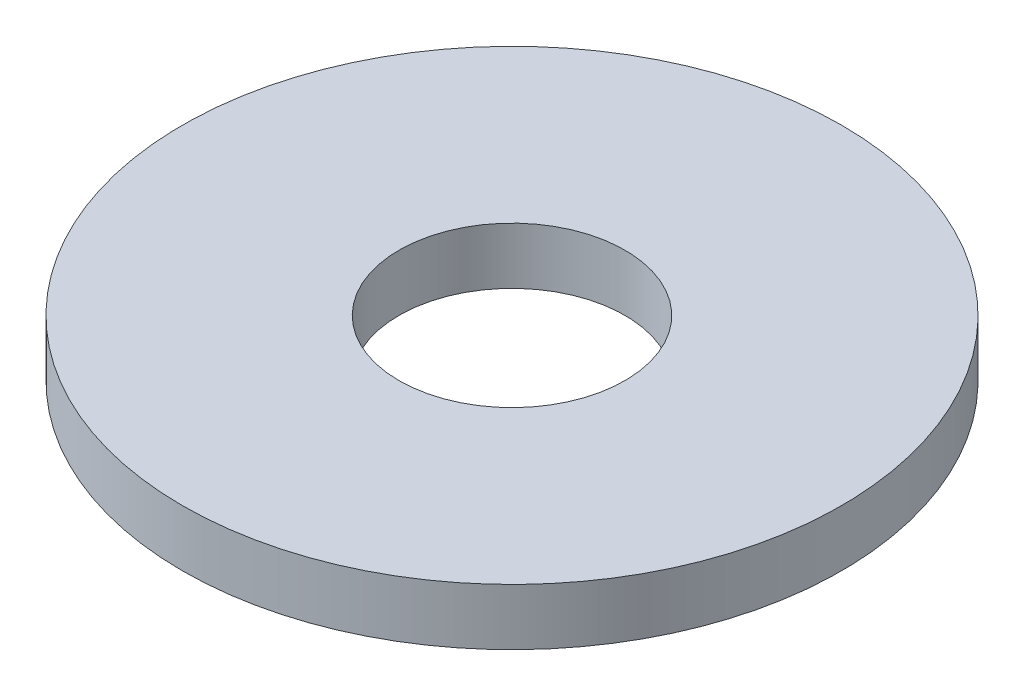
from build123d import *

# Parameters (mm, degrees)
SKETCH1_R           = 87.5
BOSS_EXTRUDE1_DEPTH = 15
SKETCH2_R           = 30
CUT_EXTRUDE1_DEPTH  = 125.649508623


with BuildPart() as part:
    # Sketch1 → Boss-Extrude1 (new body)
    with BuildSketch(Plane(origin=(0, 0, 0), x_dir=(1, 0, 0), z_dir=(0, 1, 0))):
        Circle(SKETCH1_R)
    extrude(amount=BOSS_EXTRUDE1_DEPTH)

    # Sketch2 → Cut-Extrude1 (cut, through all)
    with BuildSketch(Plane(origin=(0, 0, 0), x_dir=(1, 0, 0), z_dir=(0, 1, 0))):
        Circle(SKETCH2_R)
    extrude(amount=CUT_EXTRUDE1_DEPTH, mode=Mode.SUBTRACT)


solid = part.part
